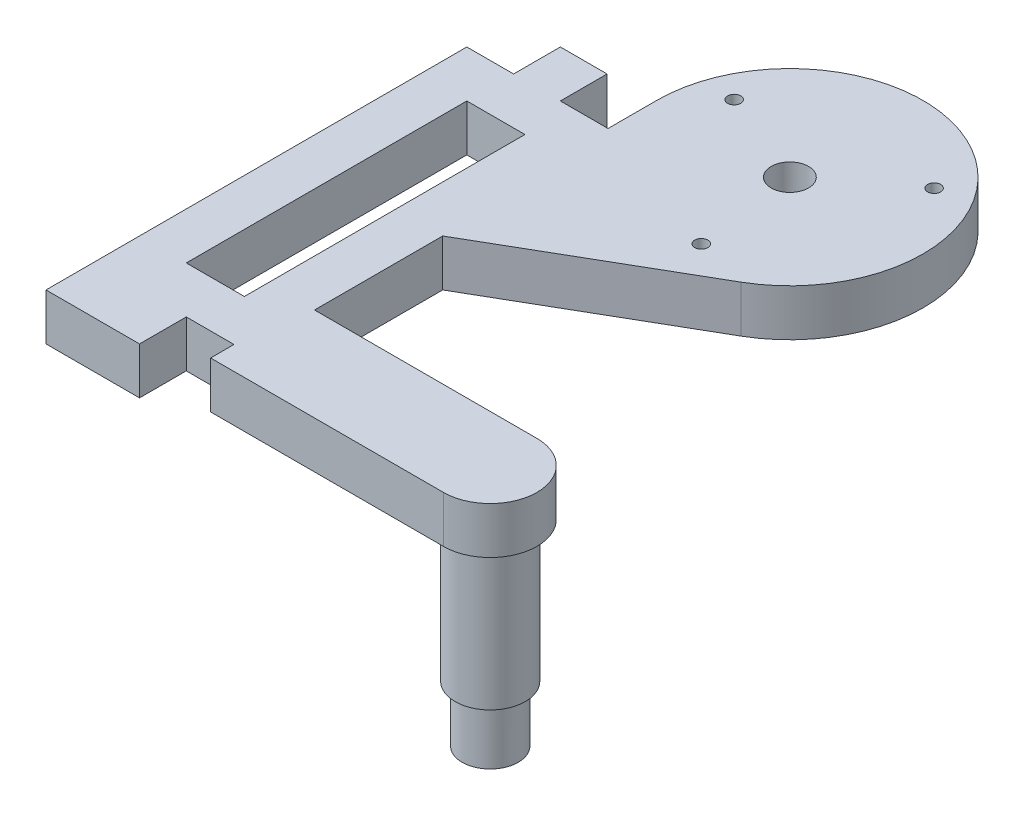
from build123d import *

# Parameters (mm, degrees)
SKETCH2_R           = 0.7
SKETCH2_R_2         = 2
SKETCH2_W           = 6.21325809
SKETCH2_H           = 30
BOSS_EXTRUDE1_DEPTH = 5
SKETCH3_R           = 3.75
BOSS_EXTRUDE2_DEPTH = 20
SKETCH4_R           = 3
SKETCH4_R_2         = 1.75
BOSS_EXTRUDE3_DEPTH = 6


with BuildPart() as part:
    # Sketch2 → Boss-Extrude1 (new body)
    with BuildSketch(Plane(origin=(0, 0, 0), x_dir=(1, 0, 0), z_dir=(0, 1, 0))):
        with BuildLine():
            Line((15.1, 45.212033947), (15.1, 40))
            Line((15.1, 40), (10, 40))
            Line((10, 40), (10, 45))
            Line((10, 45), (5, 45))
            Line((5, 45), (5, 40))
            Line((5, 40), (0, 40))
            Line((0, 40), (0, -5))
            Line((0, -5), (10, -5))
            Line((10, -5), (10, 0))
            Line((10, 0), (15.1, 0))
            Line((15.1, 0), (15.1, -2.5))
            Line((15.1, -2.5), (40, -2.5))
            ThreePointArc((40, -2.5), (45, 2.5), (40, 7.5))
            Line((40, 7.5), (16.21325809, 7.5))
            Line((16.21325809, 7.5), (16.21325809, 21.207579156))
            Line((16.21325809, 21.207579156), (36.445096698, 32.888436623))
            ThreePointArc((36.445096698, 32.888436623), (36.445096698, 57.535631272), (15.1, 45.212033947))
        make_face()
        with Locations((38.056951209, 51.908409667)):
            Circle(SKETCH2_R, mode=Mode.SUBTRACT)
        with Locations((19.167389608, 49.421551703)):
            Circle(SKETCH2_R, mode=Mode.SUBTRACT)
        with Locations((30.76585258, 34.306140472)):
            Circle(SKETCH2_R, mode=Mode.SUBTRACT)
        with Locations((29.330064466, 45.212033947)):
            Circle(SKETCH2_R_2, mode=Mode.SUBTRACT)
        with Locations((8.106629045, 20)):
            Rectangle(SKETCH2_W, SKETCH2_H, mode=Mode.SUBTRACT)
    extrude(amount=BOSS_EXTRUDE1_DEPTH)

    # Sketch3 → Boss-Extrude2 (add)
    with BuildSketch(Plane(origin=(0, 5, 0), x_dir=(1, 0, 0), z_dir=(0, 1, 0))):
        with Locations((40, 2.5)):
            Circle(SKETCH3_R)
    extrude(amount=-BOSS_EXTRUDE2_DEPTH)

    # Sketch4 → Boss-Extrude3 (add)
    with BuildSketch(Plane(origin=(0, -15, 0), x_dir=(-1, 0, 0), z_dir=(0, -1, 0))):
        with Locations((-40, 2.5)):
            Circle(SKETCH4_R)
        with Locations((-40, 2.5)):
            Circle(SKETCH4_R_2, mode=Mode.SUBTRACT)
    extrude(amount=BOSS_EXTRUDE3_DEPTH)


solid = part.part
